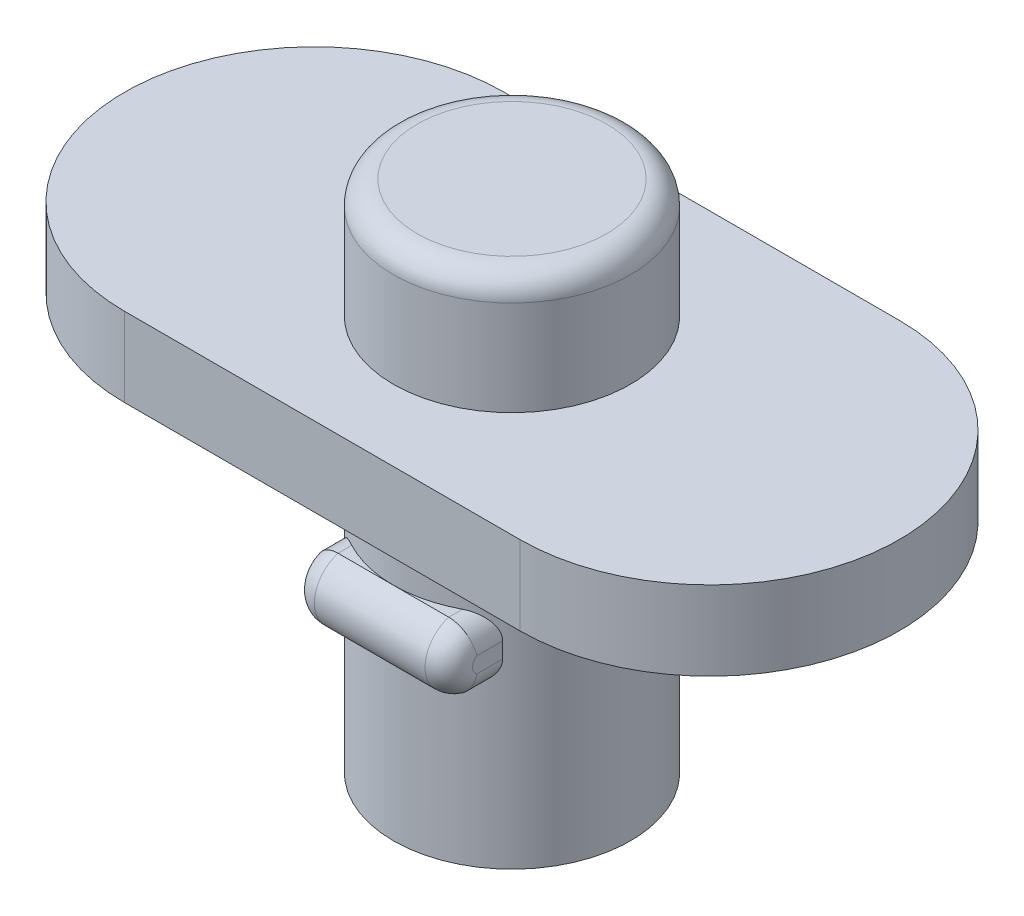
from build123d import *

# Parameters (mm, degrees)
EXTRUDE_1294_DEPTH   = 1
SKETCH_1344_R        = 1.5
EXTRUDE_1_DEPTH      = 1.5
EXTRUDE_START        = 4
SKETCH_1505_R        = 1.5
EXTRUDE_2_DEPTH      = 4
EXTRUDE_3_DEPTH      = 1.8
EXTRUDE_3_DEPTH_BACK = 1.8
CUT_EXTRUDE_1_DEPTH  = 2
SKETCH_6_W           = 1.7
SKETCH_6_H           = 1.7
CUT_EXTRUDE_2_DEPTH  = 2
FILLET_1_R           = 0.3


with BuildPart() as part:
    # Sketch 213 → Extrude 1294 (new body)
    with BuildSketch(Plane(origin=(0, 0, 0), x_dir=(1, 0, 0), z_dir=(0, 1, 0))):
        with BuildLine():
            Line((-2.4999999999999996, -2.4), (2.5000000000000004, -2.4))
            ThreePointArc((2.5000000000000004, -2.4), (4.9, 0), (2.5000000000000004, 2.4))
            Line((2.5000000000000004, 2.4), (-2.4999999999999996, 2.4))
            ThreePointArc((-2.4999999999999996, 2.4), (-4.8999999999999995, 2.9e-16), (-2.4999999999999996, -2.4))
        make_face()
    extrude(amount=EXTRUDE_1294_DEPTH)

    # Sketch 1344 → 凸台-拉伸1 (add)
    with BuildSketch(Plane(origin=(0, 1, 0), x_dir=(1, 0, 0), z_dir=(0, 1, 0))):
        Circle(SKETCH_1344_R)
    extrude(amount=EXTRUDE_1_DEPTH)

    # Sketch 1505 → 凸台-拉伸2 (add)
    with BuildSketch(Plane.XZ.offset(EXTRUDE_START)):
        Circle(SKETCH_1505_R)
    extrude(amount=-EXTRUDE_2_DEPTH)

    # Sketch 1641 → 凸台-拉伸3 (add, two sides: drawn at the far end of the back side and taken through both)
    with BuildSketch(Plane.XY.offset(-EXTRUDE_3_DEPTH_BACK)):
        Polygon((-1.0000000000000002, -2), (0.9999999999999998, -2), (0.9999999999999996, -1.2000000000000002), (-1.0000000000000004, -1.2000000000000002), align=None)
    extrude(amount=EXTRUDE_3_DEPTH + EXTRUDE_3_DEPTH_BACK)

    # 草图4 → 切除-拉伸1 (cut)
    with BuildSketch(Plane(origin=(0.9999999999999991, 2.7e-16, 0), x_dir=(0, 0, -1), z_dir=(1, 2.7e-16, 0))):
        with BuildLine():
            Line((1.8, -2), (1.8, -1.5999999999999996))
            ThreePointArc((1.7999999999999998, -1.5999999999999996), (1.7166666666666668, -1.8499999999999996), (1.5000000000000004, -2))
            Line((1.5000000000000002, -2), (1.8, -2))
        make_face()
        with BuildLine():
            Line((1.8, -1.2000000000000004), (1.5000000000000002, -1.2000000000000002))
            ThreePointArc((1.5000000000000002, -1.2000000000000002), (1.7166666666666663, -1.35), (1.7999999999999998, -1.5999999999999996))
            Line((1.8, -1.5999999999999996), (1.8, -1.2000000000000004))
        make_face()
        with BuildLine():
            Line((-1.5000000000000002, -1.2000000000000002), (-1.8, -1.2000000000000004))
            Line((-1.8, -1.2000000000000004), (-1.8, -1.6000000000000005))
            ThreePointArc((-1.7999999999999998, -1.6000000000000005), (-1.7166666666666668, -1.3500000000000005), (-1.5000000000000004, -1.2000000000000002))
        make_face()
        with BuildLine():
            ThreePointArc((-1.5000000000000002, -2), (-1.7166666666666663, -1.85), (-1.7999999999999998, -1.6000000000000005))
            Line((-1.8, -1.6000000000000005), (-1.8, -2))
            Line((-1.8, -2), (-1.5000000000000002, -2))
        make_face()
    extrude(amount=-CUT_EXTRUDE_1_DEPTH, mode=Mode.SUBTRACT)

    # 草图6 → 切除-拉伸2 (cut)
    with BuildSketch(Plane.XZ.offset(4)):
        Rectangle(SKETCH_6_W, SKETCH_6_H)
    extrude(amount=-CUT_EXTRUDE_2_DEPTH, mode=Mode.SUBTRACT)

    # 圆角1
    fillet_1_edges = [part.edges().sort_by_distance(p)[0] for p in [
        (-1.5, 2.5, -1.8e-16),
        (-1.0000000000000004, -1.2000000000000002, 1.3090169943749475),
        (-1.0000000000000004, -1.6, 1.7999999999999998),
        (-1.0000000000000002, -2, 1.3090169943749475),
        (0.9999999999999998, -2, 1.3090169943749477),
        (0.9999999999999996, -1.6000000000000003, 1.7999999999999998),
        (0.9999999999999996, -1.2000000000000002, 1.3090169943749481),
        (-1.0000000000000004, -1.2000000000000002, -1.3090169943749472),
        (-1.0000000000000004, -1.6000000000000005, -1.7999999999999998),
        (-1.0000000000000002, -2, -1.3090169943749477),
        (0.9999999999999996, -1.2000000000000002, -1.309016994374948),
        (0.9999999999999998, -2, -1.3090169943749477),
        (0.9999999999999996, -1.5999999999999994, -1.7999999999999998),
    ]]
    fillet(fillet_1_edges, radius=FILLET_1_R)


solid = part.part
